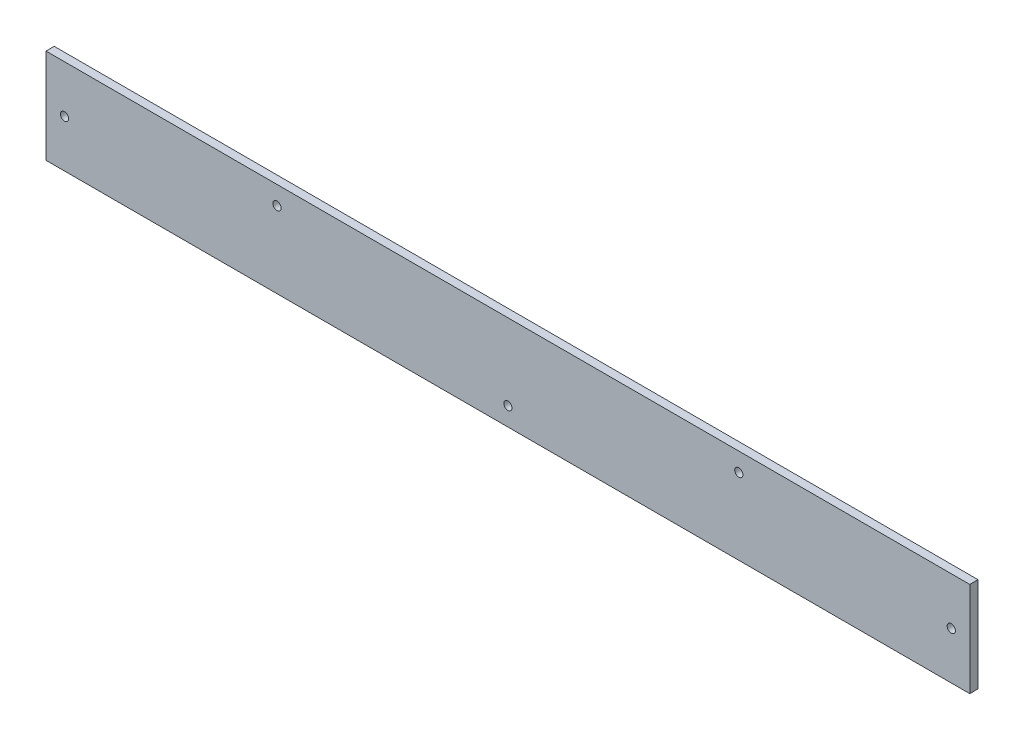
from build123d import *

# Parameters (mm, degrees)
SCHIZZO1_W                   = 449
SCHIZZO1_H                   = 46
SCHIZZO1_R                   = 2
ESTRUSIONE_ESTRUSIONE1_DEPTH = 4


with BuildPart() as part:
    # Schizzo1 → Estrusione-Estrusione1 (new body)
    with BuildSketch(Plane.XY):
        with Locations((224.5, 23)):
            Rectangle(SCHIZZO1_W, SCHIZZO1_H)
        with Locations((9, 23)):
            Circle(SCHIZZO1_R, mode=Mode.SUBTRACT)
        with Locations((112.25, 37)):
            Circle(SCHIZZO1_R, mode=Mode.SUBTRACT)
        with Locations((224.5, 9)):
            Circle(SCHIZZO1_R, mode=Mode.SUBTRACT)
        with Locations((440, 23)):
            Circle(SCHIZZO1_R, mode=Mode.SUBTRACT)
        with Locations((336.75, 37)):
            Circle(SCHIZZO1_R, mode=Mode.SUBTRACT)
    extrude(amount=ESTRUSIONE_ESTRUSIONE1_DEPTH)


solid = part.part
